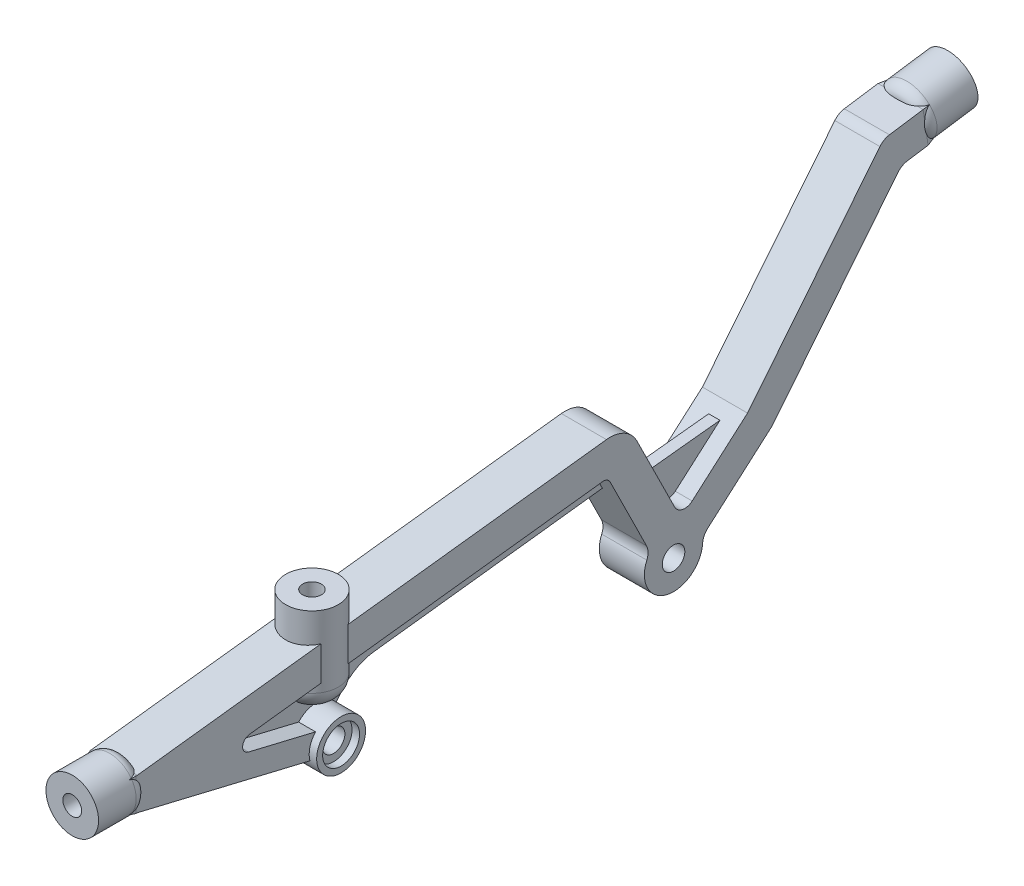
from build123d import *
from OCP.BRepFilletAPI import BRepFilletAPI_MakeChamfer
from build123d.topology import SkipClean

# Parameters (mm, degrees)
BOSS_EXTRUDE3_DEPTH      = 3
BOSS_EXTRUDE3_DEPTH_BACK = 3
SKETCH2_R                = 1.5
CHAMFER1_SIZE            = 5.5
CHAMFER1_SIZE2           = 0.969798394
SKETCH4_R                = 3.5
BOSS_EXTRUDE5_DEPTH      = 6.5
FILLET1_R                = 1.5
CHAMFER2_SIZE            = 6.5
CHAMFER2_SIZE2           = 1.146125375
SKETCH5_R                = 3.5
BOSS_EXTRUDE6_DEPTH      = 7
FILLET2_R                = 1.5
SKETCH6_R                = 1.25
CUT_EXTRUDE1_DEPTH       = 5
SKETCH7_R                = 1.25
CUT_EXTRUDE2_DEPTH       = 5
SKETCH8_R                = 3.25
SKETCH8_R_2              = 2.45625
BOSS_EXTRUDE7_DEPTH      = 1
SKETCH9_R                = 3.5
BOSS_EXTRUDE8_DEPTH      = 12
FILLET4_R                = 2.5
SKETCH10_R               = 1.25
CUT_EXTRUDE3_DEPTH       = 7.5
BOSS_EXTRUDE9_DEPTH      = 0.75
BOSS_EXTRUDE9_DEPTH_BACK = 0.75


with BuildPart() as part:
    # Sketch2 → Boss-Extrude3 (new, two sides: drawn at the far end of the back side and taken through both)
    with BuildSketch(Plane(origin=(0, 0, 0), x_dir=(0, 0, -1), z_dir=(1, 0, 0)).offset(-BOSS_EXTRUDE3_DEPTH_BACK)):
        with BuildLine():
            Line((-41.847406192, 4.214685059), (-47.504350649, 4.214685059))
            Line((-47.504350649, 4.214685059), (-47.504350649, -0.108292918))
            Line((-47.504350649, -0.108292918), (-41.847406192, -0.108292918))
            Line((-41.847406192, -0.108292918), (-18.896958647, -5.602873503))
            ThreePointArc((-18.896958647, -5.602873503), (-12.591071245, -5.627422554), (-18.143570936, -2.638348154))
            Line((-18.143570936, -2.638348154), (-27.07269919, -0.500620136))
            ThreePointArc((-27.07269919, -0.500620136), (-27.838191081, 0.529789455), (-26.958724721, 1.464808536))
            Line((-26.958724721, 1.464808536), (20.036892245, 7.090419127))
            ThreePointArc((20.036892245, 7.090419127), (20.631486114, 6.977095043), (21.051777308, 6.541504033))
            Line((21.051777308, 6.541504033), (25.882475091, -3.2073223))
            ThreePointArc((25.882475091, -3.2073223), (26.089769352, -4.044385692), (25.925361171, -4.890917429))
            ThreePointArc((25.925361171, -4.890917429), (28.584276955, -10.202316883), (33.349113245, -6.65589158))
            ThreePointArc((33.349113245, -6.65589158), (33.549055458, -5.89274102), (34.028557694, -5.26628011))
            Line((34.028557694, -5.26628011), (42.583090556, 2.221114582))
            Line((42.583090556, 2.221114582), (59.335624185, 23.053193016))
            ThreePointArc((59.335624185, 23.053193016), (59.900258067, 23.535386094), (60.601885484, 23.778368712))
            Line((60.601885484, 23.778368712), (69.77302999, 25.133284216))
            Line((69.77302999, 25.133284216), (69.115352949, 29.5849649))
            Line((69.115352949, 29.5849649), (58.200021846, 27.972368856))
            ThreePointArc((58.200021846, 27.972368856), (57.498394429, 27.729386238), (56.933760547, 27.247193161))
            Line((56.933760547, 27.247193161), (39.323061921, 5.347971039))
            Line((39.323061921, 5.347971039), (31.960980055, -1.095725371))
            ThreePointArc((31.960980055, -1.095725371), (30.681109601, -1.43831674), (29.629017471, -0.632997314))
            Line((29.629017471, -0.632997314), (24.61351539, 9.488782386))
            ThreePointArc((24.61351539, 9.488782386), (22.932350612, 11.231146425), (20.553975139, 11.684442759))
            Line((20.553975139, 11.684442759), (-41.847406192, 4.214685059))
        make_face()
        with Locations((29.480563746, -6.432397124)):
            Circle(SKETCH2_R, mode=Mode.SUBTRACT)
        with Locations((-15.740946388, -4.826931094)):
            Circle(SKETCH2_R, mode=Mode.SUBTRACT)
    extrude(amount=BOSS_EXTRUDE3_DEPTH + BOSS_EXTRUDE3_DEPTH_BACK)

    # Chamfer1: one chamfer whose edges measure the first distance from different faces: ONE call of the kernel's chamfer builder (chamfer() names one face for all edges)
    chamfer1_edges_1 = [part.edges().sort_by_distance(p)[0] for p in [
        (-3, 2.05319607, 47.504350649),
    ]]
    chamfer1_side_1 = [part.faces().sort_by_distance(p)[0] for p in [
        (-3, 6.287655967, -11.033571173),
    ]]
    chamfer1_edges_2 = [part.edges().sort_by_distance(p)[0] for p in [
        (0, -0.108292918, 47.504350649),
    ]]
    chamfer1_side_2 = [part.faces().sort_by_distance(p)[0] for p in [
        (0, -0.108292918, 44.67587842),
    ]]
    chamfer1_edges_3 = [part.edges().sort_by_distance(p)[0] for p in [
        (0, 4.214685059, 47.504350649),
    ]]
    chamfer1_side_3 = [part.faces().sort_by_distance(p)[0] for p in [
        (0, 4.214685059, 44.67587842),
    ]]
    chamfer1_edges_4 = [part.edges().sort_by_distance(p)[0] for p in [
        (3, 2.05319607, 47.504350649),
    ]]
    chamfer1_side_4 = [part.faces().sort_by_distance(p)[0] for p in [
        (3, 6.287655967, -11.033571173),
    ]]
    chamfer1 = BRepFilletAPI_MakeChamfer(part.part.solid().wrapped)
    for e in chamfer1_edges_1:
        chamfer1.Add(CHAMFER1_SIZE, CHAMFER1_SIZE2, e.wrapped, chamfer1_side_1[0].wrapped)  # the first distance lies on this face
    for e in chamfer1_edges_2:
        chamfer1.Add(CHAMFER1_SIZE, CHAMFER1_SIZE2, e.wrapped, chamfer1_side_2[0].wrapped)  # the first distance lies on this face
    for e in chamfer1_edges_3:
        chamfer1.Add(CHAMFER1_SIZE, CHAMFER1_SIZE2, e.wrapped, chamfer1_side_3[0].wrapped)  # the first distance lies on this face
    for e in chamfer1_edges_4:
        chamfer1.Add(CHAMFER1_SIZE, CHAMFER1_SIZE2, e.wrapped, chamfer1_side_4[0].wrapped)  # the first distance lies on this face
    add(Compound.cast(chamfer1.Shape()), mode=Mode.REPLACE)

    # Sketch4 → Boss-Extrude5 (add)
    with BuildSketch(Plane.XY.offset(47.504350649)):
        with Locations((0, 2.06015318)):
            Circle(SKETCH4_R)
    extrude(amount=-BOSS_EXTRUDE5_DEPTH)

    # Fillet1
    # the kernel refuses this fillet: 1.5 mm, written as the material it takes off along each edge
    with BuildSketch(Plane(origin=(0, 2.06015318, 41.004350649), x_dir=(0.04192374044801671, 0.9991208135089806, 0), z_dir=(0.9991208135089806, -0.04192374044801671, 0))) as fillet1_piece_1_section:
        with BuildLine():
            CenterArc((3.5 - FILLET1_R, FILLET1_R), FILLET1_R, 270, 90)
            Line((3.5 - FILLET1_R, 0), (3.5, 0))
            Line((3.5, 0), (3.5, FILLET1_R))
        make_face()
    fillet1_piece_1 = revolve(axis=Axis((0, 2.06015318, 41.004350649), (0, 0, 1)), revolution_arc=184.805515175, mode=Mode.PRIVATE)
    fillet1_piece_1 = split(fillet1_piece_1, bisect_by=Plane(origin=(-1.144767452, 4.344009615, 41.270914646), z_dir=(0, 0.984807753012208, 0.17364817766693078)), keep=Keep.TOP, mode=Mode.PRIVATE)
    add(fillet1_piece_1, mode=Mode.SUBTRACT)
    with BuildSketch(Plane(origin=(0, 2.06015318, 41.004350649), x_dir=(0.04192374044801671, 0.9991208135089806, 0), z_dir=(0.9991208135089806, -0.04192374044801671, 0))) as fillet1_piece_2_section:
        with BuildLine():
            CenterArc((3.5 - FILLET1_R, FILLET1_R), FILLET1_R, 270, 90)
            Line((3.5 - FILLET1_R, 0), (3.5, 0))
            Line((3.5, 0), (3.5, FILLET1_R))
        make_face()
    fillet1_piece_2 = revolve(axis=Axis((0, 2.06015318, 41.004350649), (0, 0, 1)), revolution_arc=184.805515175, mode=Mode.PRIVATE)
    fillet1_piece_2 = split(fillet1_piece_2, bisect_by=Plane(origin=(-1.98088056, 4.214685059, 41.226581935), z_dir=(0, 1, 0)), keep=Keep.TOP, mode=Mode.PRIVATE)
    fillet1_piece_2 = split(fillet1_piece_2, bisect_by=Plane(origin=(-1.98088056, 4.289448438, 41.222842676), z_dir=(0, 0.9929114459492596, 0.11885647017706114)), keep=Keep.TOP, mode=Mode.PRIVATE)
    add(fillet1_piece_2, mode=Mode.SUBTRACT)
    with BuildSketch(Plane(origin=(0, 2.06015318, 41.004350649), x_dir=(0.04192374044801671, 0.9991208135089806, 0), z_dir=(0.9991208135089806, -0.04192374044801671, 0))) as fillet1_piece_3_section:
        with BuildLine():
            CenterArc((3.5 - FILLET1_R, FILLET1_R), FILLET1_R, 270, 90)
            Line((3.5 - FILLET1_R, 0), (3.5, 0))
            Line((3.5, 0), (3.5, FILLET1_R))
        make_face()
    fillet1_piece_3 = revolve(axis=Axis((0, 2.06015318, 41.004350649), (0, 0, 1)), revolution_arc=184.805515175, mode=Mode.PRIVATE)
    fillet1_piece_3 = split(fillet1_piece_3, bisect_by=Plane(origin=(-2.965659211, 0.262612225, 42.199106941), z_dir=(-0.984807753012208, 0, 0.17364817766693078)), keep=Keep.TOP, mode=Mode.PRIVATE)
    add(fillet1_piece_3, mode=Mode.SUBTRACT)
    with BuildSketch(Plane(origin=(0, 2.06015318, 41.004350649), x_dir=(0.04192374044801671, 0.9991208135089806, 0), z_dir=(0.9991208135089806, -0.04192374044801671, 0))) as fillet1_piece_4_section:
        with BuildLine():
            CenterArc((3.5 - FILLET1_R, FILLET1_R), FILLET1_R, 270, 90)
            Line((3.5 - FILLET1_R, 0), (3.5, 0))
            Line((3.5, 0), (3.5, FILLET1_R))
        make_face()
    fillet1_piece_4 = revolve(axis=Axis((0, 2.06015318, 41.004350649), (0, 0, 1)), revolution_arc=184.805515175, mode=Mode.PRIVATE)
    fillet1_piece_4 = split(fillet1_piece_4, bisect_by=Plane(origin=(-3, 2.060153209, 41.267954921), z_dir=(-1, 0, 0)), keep=Keep.TOP, mode=Mode.PRIVATE)
    add(fillet1_piece_4, mode=Mode.SUBTRACT)
    with BuildSketch(Plane(origin=(0, 2.06015318, 41.004350649), x_dir=(0.04192374044801671, 0.9991208135089806, 0), z_dir=(0.9991208135089806, -0.04192374044801671, 0))) as fillet1_piece_5_section:
        with BuildLine():
            CenterArc((3.5 - FILLET1_R, FILLET1_R), FILLET1_R, 270, 90)
            Line((3.5 - FILLET1_R, 0), (3.5, 0))
            Line((3.5, 0), (3.5, FILLET1_R))
        make_face()
    fillet1_piece_5 = revolve(axis=Axis((0, 2.06015318, 41.004350649), (0, 0, 1)), revolution_arc=184.805515175, mode=Mode.PRIVATE)
    fillet1_piece_5 = split(fillet1_piece_5, bisect_by=Plane(origin=(-2.550851297, -0.143060854, 41.702183155), z_dir=(0, -0.9725172253402184, 0.23283093956036607)), keep=Keep.TOP, mode=Mode.PRIVATE)
    fillet1_piece_5 = split(fillet1_piece_5, bisect_by=Plane(origin=(-2.550851297, -0.108292918, 41.704499733), z_dir=(0, -1, 0)), keep=Keep.TOP, mode=Mode.PRIVATE)
    add(fillet1_piece_5, mode=Mode.SUBTRACT)
    with BuildSketch(Plane(origin=(0, 2.06015318, 41.004350649), x_dir=(0.04192374044801671, 0.9991208135089806, 0), z_dir=(0.9991208135089806, -0.04192374044801671, 0))) as fillet1_piece_6_section:
        with BuildLine():
            CenterArc((3.5 - FILLET1_R, FILLET1_R), FILLET1_R, 270, 90)
            Line((3.5 - FILLET1_R, 0), (3.5, 0))
            Line((3.5, 0), (3.5, FILLET1_R))
        make_face()
    fillet1_piece_6 = revolve(axis=Axis((0, 2.06015318, 41.004350649), (0, 0, 1)), revolution_arc=184.805515175, mode=Mode.PRIVATE)
    fillet1_piece_6 = split(fillet1_piece_6, bisect_by=Plane(origin=(-2.739285489, -0.108292918, 42.203267958), z_dir=(0, 1, 0)), keep=Keep.TOP, mode=Mode.PRIVATE)
    fillet1_piece_6 = split(fillet1_piece_6, bisect_by=Plane(origin=(-2.739285489, -0.073748336, 42.200262712), z_dir=(0, -0.9848077530122082, 0.17364817766693047)), keep=Keep.TOP, mode=Mode.PRIVATE)
    add(fillet1_piece_6, mode=Mode.SUBTRACT)
    with BuildSketch(Plane(origin=(0, 2.06015318, 41.004350649), x_dir=(1, 0, 0), z_dir=(0, -1, 0))) as fillet1_piece_7_section:
        with BuildLine():
            CenterArc((3.5 - FILLET1_R, FILLET1_R), FILLET1_R, 270, 90)
            Line((3.5 - FILLET1_R, 0), (3.5, 0))
            Line((3.5, 0), (3.5, FILLET1_R))
        make_face()
    fillet1_piece_7 = revolve(axis=Axis((0, 2.06015318, 41.004350649), (0, 0, 1)), revolution_arc=92.393979849, mode=Mode.PRIVATE)
    fillet1_piece_7 = split(fillet1_piece_7, bisect_by=Plane(origin=(3.092592479, 2.737440742, 41.479232603), z_dir=(0.984807753012208, 0, 0.17364817766693078)), keep=Keep.TOP, mode=Mode.PRIVATE)
    add(fillet1_piece_7, mode=Mode.SUBTRACT)
    with BuildSketch(Plane(origin=(0, 2.06015318, 41.004350649), x_dir=(1, 0, 0), z_dir=(0, -1, 0))) as fillet1_piece_8_section:
        with BuildLine():
            CenterArc((3.5 - FILLET1_R, FILLET1_R), FILLET1_R, 270, 90)
            Line((3.5 - FILLET1_R, 0), (3.5, 0))
            Line((3.5, 0), (3.5, FILLET1_R))
        make_face()
    fillet1_piece_8 = revolve(axis=Axis((0, 2.06015318, 41.004350649), (0, 0, 1)), revolution_arc=92.393979849, mode=Mode.PRIVATE)
    fillet1_piece_8 = split(fillet1_piece_8, bisect_by=Plane(origin=(3, 2.979684864, 41.26795494), z_dir=(1, 0, 0)), keep=Keep.TOP, mode=Mode.PRIVATE)
    add(fillet1_piece_8, mode=Mode.SUBTRACT)
    with BuildSketch(Plane(origin=(0, 2.06015318, 41.004350649), x_dir=(1, 0, 0), z_dir=(0, -1, 0))) as fillet1_piece_9_section:
        with BuildLine():
            CenterArc((3.5 - FILLET1_R, FILLET1_R), FILLET1_R, 270, 90)
            Line((3.5 - FILLET1_R, 0), (3.5, 0))
            Line((3.5, 0), (3.5, FILLET1_R))
        make_face()
    fillet1_piece_9 = revolve(axis=Axis((0, 2.06015318, 41.004350649), (0, 0, 1)), revolution_arc=92.393979849, mode=Mode.PRIVATE)
    fillet1_piece_9 = split(fillet1_piece_9, bisect_by=Plane(origin=(2.808020408, 4.14438703, 42.40303058), z_dir=(0, 0.984807753012208, 0.17364817766693078)), keep=Keep.TOP, mode=Mode.PRIVATE)
    add(fillet1_piece_9, mode=Mode.SUBTRACT)
    with BuildSketch(Plane(origin=(0, 2.06015318, 41.004350649), x_dir=(1, 0, 0), z_dir=(0, -1, 0))) as fillet1_piece_10_section:
        with BuildLine():
            CenterArc((3.5 - FILLET1_R, FILLET1_R), FILLET1_R, 270, 90)
            Line((3.5 - FILLET1_R, 0), (3.5, 0))
            Line((3.5, 0), (3.5, FILLET1_R))
        make_face()
    fillet1_piece_10 = revolve(axis=Axis((0, 2.06015318, 41.004350649), (0, 0, 1)), revolution_arc=92.393979849, mode=Mode.PRIVATE)
    fillet1_piece_10 = split(fillet1_piece_10, bisect_by=Plane(origin=(1.980919647, 4.28944822, 41.222844499), z_dir=(0, 0.9929114459492596, 0.11885647017706114)), keep=Keep.TOP, mode=Mode.PRIVATE)
    fillet1_piece_10 = split(fillet1_piece_10, bisect_by=Plane(origin=(1.980919647, 4.214685059, 41.226583423), z_dir=(0, 1, 0)), keep=Keep.TOP, mode=Mode.PRIVATE)
    add(fillet1_piece_10, mode=Mode.SUBTRACT)
    with BuildSketch(Plane(origin=(0, 2.06015318, 41.004350649), x_dir=(-0.9467133479800277, 0.3220773769708873, 0), z_dir=(0.3220773769708873, 0.9467133479800277, 0))) as fillet1_piece_11_section:
        with BuildLine():
            CenterArc((3.5 - FILLET1_R, FILLET1_R), FILLET1_R, 270, 90)
            Line((3.5 - FILLET1_R, 0), (3.5, 0))
            Line((3.5, 0), (3.5, FILLET1_R))
        make_face()
    fillet1_piece_11 = revolve(axis=Axis((0, 2.06015318, 41.004350649), (0, 0, 1)), revolution_arc=217.577204913, mode=Mode.PRIVATE)
    fillet1_piece_11 = split(fillet1_piece_11, bisect_by=Plane(origin=(-3.095548759, 1.915452294, 41.462466708), z_dir=(-0.984807753012208, 0, 0.17364817766693078)), keep=Keep.TOP, mode=Mode.PRIVATE)
    add(fillet1_piece_11, mode=Mode.SUBTRACT)
    with BuildSketch(Plane(origin=(0, 2.06015318, 41.004350649), x_dir=(-0.9467133479800277, 0.3220773769708873, 0), z_dir=(0.3220773769708873, 0.9467133479800277, 0))) as fillet1_piece_12_section:
        with BuildLine():
            CenterArc((3.5 - FILLET1_R, FILLET1_R), FILLET1_R, 270, 90)
            Line((3.5 - FILLET1_R, 0), (3.5, 0))
            Line((3.5, 0), (3.5, FILLET1_R))
        make_face()
    fillet1_piece_12 = revolve(axis=Axis((0, 2.06015318, 41.004350649), (0, 0, 1)), revolution_arc=217.577204913, mode=Mode.PRIVATE)
    fillet1_piece_12 = split(fillet1_piece_12, bisect_by=Plane(origin=(-3, 1.661101297, 41.251445083), z_dir=(-1, 0, 0)), keep=Keep.TOP, mode=Mode.PRIVATE)
    add(fillet1_piece_12, mode=Mode.SUBTRACT)
    with BuildSketch(Plane(origin=(0, 2.06015318, 41.004350649), x_dir=(-0.9467133479800277, 0.3220773769708873, 0), z_dir=(0.3220773769708873, 0.9467133479800277, 0))) as fillet1_piece_13_section:
        with BuildLine():
            CenterArc((3.5 - FILLET1_R, FILLET1_R), FILLET1_R, 270, 90)
            Line((3.5 - FILLET1_R, 0), (3.5, 0))
            Line((3.5, 0), (3.5, FILLET1_R))
        make_face()
    fillet1_piece_13 = revolve(axis=Axis((0, 2.06015318, 41.004350649), (0, 0, 1)), revolution_arc=217.577204913, mode=Mode.PRIVATE)
    fillet1_piece_13 = split(fillet1_piece_13, bisect_by=Plane(origin=(3, 1.661101311, 41.251445112), z_dir=(1, 0, 0)), keep=Keep.TOP, mode=Mode.PRIVATE)
    add(fillet1_piece_13, mode=Mode.SUBTRACT)
    with BuildSketch(Plane(origin=(0, 2.06015318, 41.004350649), x_dir=(-0.9467133479800277, 0.3220773769708873, 0), z_dir=(0.3220773769708873, 0.9467133479800277, 0))) as fillet1_piece_14_section:
        with BuildLine():
            CenterArc((3.5 - FILLET1_R, FILLET1_R), FILLET1_R, 270, 90)
            Line((3.5 - FILLET1_R, 0), (3.5, 0))
            Line((3.5, 0), (3.5, FILLET1_R))
        make_face()
    fillet1_piece_14 = revolve(axis=Axis((0, 2.06015318, 41.004350649), (0, 0, 1)), revolution_arc=217.577204913, mode=Mode.PRIVATE)
    fillet1_piece_14 = split(fillet1_piece_14, bisect_by=Plane(origin=(2.965659211, 0.262612225, 42.19910694), z_dir=(0.984807753012208, 0, 0.17364817766693078)), keep=Keep.TOP, mode=Mode.PRIVATE)
    add(fillet1_piece_14, mode=Mode.SUBTRACT)
    with BuildSketch(Plane(origin=(0, 2.06015318, 41.004350649), x_dir=(-0.9467133479800277, 0.3220773769708873, 0), z_dir=(0.3220773769708873, 0.9467133479800277, 0))) as fillet1_piece_15_section:
        with BuildLine():
            CenterArc((3.5 - FILLET1_R, FILLET1_R), FILLET1_R, 270, 90)
            Line((3.5 - FILLET1_R, 0), (3.5, 0))
            Line((3.5, 0), (3.5, FILLET1_R))
        make_face()
    fillet1_piece_15 = revolve(axis=Axis((0, 2.06015318, 41.004350649), (0, 0, 1)), revolution_arc=217.577204913, mode=Mode.PRIVATE)
    fillet1_piece_15 = split(fillet1_piece_15, bisect_by=Plane(origin=(2.739285464, -0.02676555, 42.187939845), z_dir=(0, -0.9725172253402184, 0.23283093956036607)), keep=Keep.TOP, mode=Mode.PRIVATE)
    fillet1_piece_15 = split(fillet1_piece_15, bisect_by=Plane(origin=(2.739285464, -0.073748254, 42.200263173), z_dir=(0, -0.9848077530122082, 0.17364817766693047)), keep=Keep.TOP, mode=Mode.PRIVATE)
    add(fillet1_piece_15, mode=Mode.SUBTRACT)
    with BuildSketch(Plane(origin=(0, 2.06015318, 41.004350649), x_dir=(-0.9467133479800277, 0.3220773769708873, 0), z_dir=(0.3220773769708873, 0.9467133479800277, 0))) as fillet1_piece_16_section:
        with BuildLine():
            CenterArc((3.5 - FILLET1_R, FILLET1_R), FILLET1_R, 270, 90)
            Line((3.5 - FILLET1_R, 0), (3.5, 0))
            Line((3.5, 0), (3.5, FILLET1_R))
        make_face()
    fillet1_piece_16 = revolve(axis=Axis((0, 2.06015318, 41.004350649), (0, 0, 1)), revolution_arc=217.577204913, mode=Mode.PRIVATE)
    fillet1_piece_16 = split(fillet1_piece_16, bisect_by=Plane(origin=(2.55085127, -0.143060856, 41.702183144), z_dir=(0, -0.9725172253402184, 0.23283093956036607)), keep=Keep.TOP, mode=Mode.PRIVATE)
    fillet1_piece_16 = split(fillet1_piece_16, bisect_by=Plane(origin=(2.55085127, -0.108292918, 41.704499723), z_dir=(0, -1, 0)), keep=Keep.TOP, mode=Mode.PRIVATE)
    add(fillet1_piece_16, mode=Mode.SUBTRACT)
    with BuildSketch(Plane(origin=(0, 2.06015318, 41.004350649), x_dir=(0.9317111197747436, -0.3632002055176914, 0), z_dir=(-0.3632002055176914, -0.9317111197747436, 0))) as fillet1_piece_17_section:
        with BuildLine():
            CenterArc((3.5 - FILLET1_R, FILLET1_R), FILLET1_R, 270, 90)
            Line((3.5 - FILLET1_R, 0), (3.5, 0))
            Line((3.5, 0), (3.5, FILLET1_R))
        make_face()
    fillet1_piece_17 = revolve(axis=Axis((0, 2.06015318, 41.004350649), (0, 0, 1)), revolution_arc=222.593724351, mode=Mode.PRIVATE)
    fillet1_piece_17 = split(fillet1_piece_17, bisect_by=Plane(origin=(3.095045388, 2.152504138, 41.46532147), z_dir=(0.984807753012208, 0, 0.17364817766693078)), keep=Keep.TOP, mode=Mode.PRIVATE)
    add(fillet1_piece_17, mode=Mode.SUBTRACT)
    with BuildSketch(Plane(origin=(0, 2.06015318, 41.004350649), x_dir=(0.9317111197747436, -0.3632002055176914, 0), z_dir=(-0.3632002055176914, -0.9317111197747436, 0))) as fillet1_piece_18_section:
        with BuildLine():
            CenterArc((3.5 - FILLET1_R, FILLET1_R), FILLET1_R, 270, 90)
            Line((3.5 - FILLET1_R, 0), (3.5, 0))
            Line((3.5, 0), (3.5, FILLET1_R))
        make_face()
    fillet1_piece_18 = revolve(axis=Axis((0, 2.06015318, 41.004350649), (0, 0, 1)), revolution_arc=222.593724351, mode=Mode.PRIVATE)
    fillet1_piece_18 = split(fillet1_piece_18, bisect_by=Plane(origin=(3, 2.371265463, 41.252663145), z_dir=(1, 0, 0)), keep=Keep.TOP, mode=Mode.PRIVATE)
    add(fillet1_piece_18, mode=Mode.SUBTRACT)
    with BuildSketch(Plane(origin=(0, 2.06015318, 41.004350649), x_dir=(0.9317111197747436, -0.3632002055176914, 0), z_dir=(-0.3632002055176914, -0.9317111197747436, 0))) as fillet1_piece_19_section:
        with BuildLine():
            CenterArc((3.5 - FILLET1_R, FILLET1_R), FILLET1_R, 270, 90)
            Line((3.5 - FILLET1_R, 0), (3.5, 0))
            Line((3.5, 0), (3.5, FILLET1_R))
        make_face()
    fillet1_piece_19 = revolve(axis=Axis((0, 2.06015318, 41.004350649), (0, 0, 1)), revolution_arc=222.593724351, mode=Mode.PRIVATE)
    fillet1_piece_19 = split(fillet1_piece_19, bisect_by=Plane(origin=(-3, 2.371265462, 41.252663165), z_dir=(-1, 0, 0)), keep=Keep.TOP, mode=Mode.PRIVATE)
    add(fillet1_piece_19, mode=Mode.SUBTRACT)
    with BuildSketch(Plane(origin=(0, 2.06015318, 41.004350649), x_dir=(0.9317111197747436, -0.3632002055176914, 0), z_dir=(-0.3632002055176914, -0.9317111197747436, 0))) as fillet1_piece_20_section:
        with BuildLine():
            CenterArc((3.5 - FILLET1_R, FILLET1_R), FILLET1_R, 270, 90)
            Line((3.5 - FILLET1_R, 0), (3.5, 0))
            Line((3.5, 0), (3.5, FILLET1_R))
        make_face()
    fillet1_piece_20 = revolve(axis=Axis((0, 2.06015318, 41.004350649), (0, 0, 1)), revolution_arc=222.593724351, mode=Mode.PRIVATE)
    fillet1_piece_20 = split(fillet1_piece_20, bisect_by=Plane(origin=(-2.965659309, 3.857694157, 42.199106385), z_dir=(-0.984807753012208, 0, 0.17364817766693078)), keep=Keep.TOP, mode=Mode.PRIVATE)
    add(fillet1_piece_20, mode=Mode.SUBTRACT)
    with BuildSketch(Plane(origin=(0, 2.06015318, 41.004350649), x_dir=(0.9317111197747436, -0.3632002055176914, 0), z_dir=(-0.3632002055176914, -0.9317111197747436, 0))) as fillet1_piece_21_section:
        with BuildLine():
            CenterArc((3.5 - FILLET1_R, FILLET1_R), FILLET1_R, 270, 90)
            Line((3.5 - FILLET1_R, 0), (3.5, 0))
            Line((3.5, 0), (3.5, FILLET1_R))
        make_face()
    fillet1_piece_21 = revolve(axis=Axis((0, 2.06015318, 41.004350649), (0, 0, 1)), revolution_arc=222.593724351, mode=Mode.PRIVATE)
    fillet1_piece_21 = split(fillet1_piece_21, bisect_by=Plane(origin=(-2.808020404, 4.144387171, 42.403029783), z_dir=(0, 0.984807753012208, 0.17364817766693078)), keep=Keep.TOP, mode=Mode.PRIVATE)
    add(fillet1_piece_21, mode=Mode.SUBTRACT)
    with BuildSketch(Plane(origin=(0, 2.06015318, 41.004350649), x_dir=(0.9317111197747436, -0.3632002055176914, 0), z_dir=(-0.3632002055176914, -0.9317111197747436, 0))) as fillet1_piece_22_section:
        with BuildLine():
            CenterArc((3.5 - FILLET1_R, FILLET1_R), FILLET1_R, 270, 90)
            Line((3.5 - FILLET1_R, 0), (3.5, 0))
            Line((3.5, 0), (3.5, FILLET1_R))
        make_face()
    fillet1_piece_22 = revolve(axis=Axis((0, 2.06015318, 41.004350649), (0, 0, 1)), revolution_arc=222.593724351, mode=Mode.PRIVATE)
    fillet1_piece_22 = split(fillet1_piece_22, bisect_by=Plane(origin=(1.254176178, 4.214685059, 41.116803645), z_dir=(0, 1, 0)), keep=Keep.TOP, mode=Mode.PRIVATE)
    fillet1_piece_22 = split(fillet1_piece_22, bisect_by=Plane(origin=(1.254176178, 4.302341009, 41.115139821), z_dir=(0, 0.9929114459492596, 0.11885647017706114)), keep=Keep.TOP, mode=Mode.PRIVATE)
    add(fillet1_piece_22, mode=Mode.SUBTRACT)
    with BuildSketch(Plane(origin=(0, 2.06015318, 41.004350649), x_dir=(-0.041770674206742874, -0.9991272245196375, 0), z_dir=(-0.9991272245196375, 0.041770674206742874, 0))) as fillet1_piece_23_section:
        with BuildLine():
            CenterArc((3.5 - FILLET1_R, FILLET1_R), FILLET1_R, 270, 90)
            Line((3.5 - FILLET1_R, 0), (3.5, 0))
            Line((3.5, 0), (3.5, FILLET1_R))
        make_face()
    fillet1_piece_23 = revolve(axis=Axis((0, 2.06015318, 41.004350649), (0, 0, 1)), revolution_arc=92.393979849, mode=Mode.PRIVATE)
    fillet1_piece_23 = split(fillet1_piece_23, bisect_by=Plane(origin=(1.133722767, -0.254084438, 41.238446042), z_dir=(0, -0.9725172253402184, 0.23283093956036607)), keep=Keep.TOP, mode=Mode.PRIVATE)
    fillet1_piece_23 = split(fillet1_piece_23, bisect_by=Plane(origin=(1.133722767, -0.237034083, 41.274223222), z_dir=(0, -0.9848077530122082, 0.17364817766693047)), keep=Keep.TOP, mode=Mode.PRIVATE)
    add(fillet1_piece_23, mode=Mode.SUBTRACT)
    with BuildSketch(Plane(origin=(0, 2.06015318, 41.004350649), x_dir=(-0.041770674206742874, -0.9991272245196375, 0), z_dir=(-0.9991272245196375, 0.041770674206742874, 0))) as fillet1_piece_24_section:
        with BuildLine():
            CenterArc((3.5 - FILLET1_R, FILLET1_R), FILLET1_R, 270, 90)
            Line((3.5 - FILLET1_R, 0), (3.5, 0))
            Line((3.5, 0), (3.5, FILLET1_R))
        make_face()
    fillet1_piece_24 = revolve(axis=Axis((0, 2.06015318, 41.004350649), (0, 0, 1)), revolution_arc=92.393979849, mode=Mode.PRIVATE)
    fillet1_piece_24 = split(fillet1_piece_24, bisect_by=Plane(origin=(2.550851289, -0.143060858, 41.702183138), z_dir=(0, -0.9725172253402184, 0.23283093956036607)), keep=Keep.TOP, mode=Mode.PRIVATE)
    fillet1_piece_24 = split(fillet1_piece_24, bisect_by=Plane(origin=(2.550851289, -0.108292918, 41.704499714), z_dir=(0, -1, 0)), keep=Keep.TOP, mode=Mode.PRIVATE)
    add(fillet1_piece_24, mode=Mode.SUBTRACT)
    with BuildSketch(Plane(origin=(0, 2.06015318, 41.004350649), x_dir=(-0.041770674206742874, -0.9991272245196375, 0), z_dir=(-0.9991272245196375, 0.041770674206742874, 0))) as fillet1_piece_25_section:
        with BuildLine():
            CenterArc((3.5 - FILLET1_R, FILLET1_R), FILLET1_R, 270, 90)
            Line((3.5 - FILLET1_R, 0), (3.5, 0))
            Line((3.5, 0), (3.5, FILLET1_R))
        make_face()
    fillet1_piece_25 = revolve(axis=Axis((0, 2.06015318, 41.004350649), (0, 0, 1)), revolution_arc=92.393979849, mode=Mode.PRIVATE)
    fillet1_piece_25 = split(fillet1_piece_25, bisect_by=Plane(origin=(3, 1.140621517, 41.267954982), z_dir=(1, 0, 0)), keep=Keep.TOP, mode=Mode.PRIVATE)
    add(fillet1_piece_25, mode=Mode.SUBTRACT)
    with BuildSketch(Plane(origin=(0, 2.06015318, 41.004350649), x_dir=(-0.041770674206742874, -0.9991272245196375, 0), z_dir=(-0.9991272245196375, 0.041770674206742874, 0))) as fillet1_piece_26_section:
        with BuildLine():
            CenterArc((3.5 - FILLET1_R, FILLET1_R), FILLET1_R, 270, 90)
            Line((3.5 - FILLET1_R, 0), (3.5, 0))
            Line((3.5, 0), (3.5, FILLET1_R))
        make_face()
    fillet1_piece_26 = revolve(axis=Axis((0, 2.06015318, 41.004350649), (0, 0, 1)), revolution_arc=92.393979849, mode=Mode.PRIVATE)
    fillet1_piece_26 = split(fillet1_piece_26, bisect_by=Plane(origin=(2.965659211, 0.262612226, 42.199106942), z_dir=(0.984807753012208, 0, 0.17364817766693078)), keep=Keep.TOP, mode=Mode.PRIVATE)
    add(fillet1_piece_26, mode=Mode.SUBTRACT)

    # Chamfer2: one chamfer whose edges measure the first distance from different faces: ONE call of the kernel's chamfer builder (chamfer() names one face for all edges)
    chamfer2_edges_1 = [part.edges().sort_by_distance(p)[0] for p in [
        (0, 29.5849649, -69.115352949),
    ]]
    chamfer2_side_1 = [part.faces().sort_by_distance(p)[0] for p in [
        (0, 28.778666878, -63.657687398),
    ]]
    chamfer2_edges_2 = [part.edges().sort_by_distance(p)[0] for p in [
        (0, 25.133284216, -69.77302999),
    ]]
    chamfer2_side_2 = [part.faces().sort_by_distance(p)[0] for p in [
        (0, 24.455826464, -65.187457737),
    ]]
    chamfer2_edges_3 = [part.edges().sort_by_distance(p)[0] for p in [
        (-3, 27.359124558, -69.444191469),
    ]]
    chamfer2_side_3 = [part.faces().sort_by_distance(p)[0] for p in [
        (-3, 6.438644919, -13.016769685),
    ]]
    chamfer2_edges_4 = [part.edges().sort_by_distance(p)[0] for p in [
        (3, 27.359124558, -69.444191469),
    ]]
    chamfer2_side_4 = [part.faces().sort_by_distance(p)[0] for p in [
        (3, 6.438644909, -13.016769556),
    ]]
    chamfer2 = BRepFilletAPI_MakeChamfer(part.part.solid().wrapped)
    for e in chamfer2_edges_1:
        chamfer2.Add(CHAMFER2_SIZE, CHAMFER2_SIZE2, e.wrapped, chamfer2_side_1[0].wrapped)  # the first distance lies on this face
    for e in chamfer2_edges_2:
        chamfer2.Add(CHAMFER2_SIZE, CHAMFER2_SIZE2, e.wrapped, chamfer2_side_2[0].wrapped)  # the first distance lies on this face
    for e in chamfer2_edges_3:
        chamfer2.Add(CHAMFER2_SIZE, CHAMFER2_SIZE2, e.wrapped, chamfer2_side_3[0].wrapped)  # the first distance lies on this face
    for e in chamfer2_edges_4:
        chamfer2.Add(CHAMFER2_SIZE, CHAMFER2_SIZE2, e.wrapped, chamfer2_side_4[0].wrapped)  # the first distance lies on this face
    add(Compound.cast(chamfer2.Shape()), mode=Mode.REPLACE)

    # Sketch5 → Boss-Extrude6 (add)
    with BuildSketch(Plane(origin=(0, 10.62471036, -71.916480205), x_dir=(-1, 0, 0), z_dir=(0, 0.14615045349945946, -0.9892623741666832))):
        with Locations(Location((0, 16.916052439, 0), (0, 0, 90))):
            Circle(SKETCH5_R)
    extrude(amount=-BOSS_EXTRUDE6_DEPTH)

    # Fillet2
    # the kernel refuses this fillet: 1.5 mm, written as the material it takes off along each edge
    with BuildSketch(Plane(origin=(0, 26.336071383, -62.51935485), x_dir=(-0.04192374044801691, 0.9883926280512421, 0.14602195999508588), z_dir=(-0.9991208135089809, -0.041473579009553015, -0.006127173678871303))) as fillet2_piece_1_section:
        with BuildLine():
            CenterArc((3.5 - FILLET2_R, FILLET2_R), FILLET2_R, 270, 90)
            Line((3.5 - FILLET2_R, 0), (3.5, 0))
            Line((3.5, 0), (3.5, FILLET2_R))
        make_face()
    fillet2_piece_1 = revolve(axis=Axis((0, 26.336071383, -62.51935485), (0, 0.14615045349945946, -0.9892623741666832)), revolution_arc=184.805515175, mode=Mode.PRIVATE)
    fillet2_piece_1 = split(fillet2_piece_1, bisect_by=Plane(origin=(1.133112953, 28.64164686, -62.44613546), z_dir=(0, 0.99961201575799, -0.027853508795987945)), keep=Keep.TOP, mode=Mode.PRIVATE)
    add(fillet2_piece_1, mode=Mode.SUBTRACT)
    with BuildSketch(Plane(origin=(0, 26.336071383, -62.51935485), x_dir=(-0.04192374044801691, 0.9883926280512421, 0.14602195999508588), z_dir=(-0.9991208135089809, -0.041473579009553015, -0.006127173678871303))) as fillet2_piece_2_section:
        with BuildLine():
            CenterArc((3.5 - FILLET2_R, FILLET2_R), FILLET2_R, 270, 90)
            Line((3.5 - FILLET2_R, 0), (3.5, 0))
            Line((3.5, 0), (3.5, FILLET2_R))
        make_face()
    fillet2_piece_2 = revolve(axis=Axis((0, 26.336071383, -62.51935485), (0, 0.14615045349945946, -0.9892623741666832)), revolution_arc=184.805515175, mode=Mode.PRIVATE)
    fillet2_piece_2 = split(fillet2_piece_2, bisect_by=Plane(origin=(1.79174701, 28.579661756, -62.310662636), z_dir=(0, 0.9892623741666831, 0.14615045349945954)), keep=Keep.TOP, mode=Mode.PRIVATE)
    add(fillet2_piece_2, mode=Mode.SUBTRACT)
    with BuildSketch(Plane(origin=(0, 26.336071383, -62.51935485), x_dir=(-0.04192374044801691, 0.9883926280512421, 0.14602195999508588), z_dir=(-0.9991208135089809, -0.041473579009553015, -0.006127173678871303))) as fillet2_piece_3_section:
        with BuildLine():
            CenterArc((3.5 - FILLET2_R, FILLET2_R), FILLET2_R, 270, 90)
            Line((3.5 - FILLET2_R, 0), (3.5, 0))
            Line((3.5, 0), (3.5, FILLET2_R))
        make_face()
    fillet2_piece_3 = revolve(axis=Axis((0, 26.336071383, -62.51935485), (0, 0.14615045349945946, -0.9892623741666832)), revolution_arc=184.805515175, mode=Mode.PRIVATE)
    fillet2_piece_3 = split(fillet2_piece_3, bisect_by=Plane(origin=(1.79174729, 24.127981067, -62.968339644), z_dir=(0, -0.989262374166683, -0.14615045349946)), keep=Keep.TOP, mode=Mode.PRIVATE)
    add(fillet2_piece_3, mode=Mode.SUBTRACT)
    with BuildSketch(Plane(origin=(0, 26.336071383, -62.51935485), x_dir=(-0.04192374044801691, 0.9883926280512421, 0.14602195999508588), z_dir=(-0.9991208135089809, -0.041473579009553015, -0.006127173678871303))) as fillet2_piece_4_section:
        with BuildLine():
            CenterArc((3.5 - FILLET2_R, FILLET2_R), FILLET2_R, 270, 90)
            Line((3.5 - FILLET2_R, 0), (3.5, 0))
            Line((3.5, 0), (3.5, FILLET2_R))
        make_face()
    fillet2_piece_4 = revolve(axis=Axis((0, 26.336071383, -62.51935485), (0, 0.14615045349945946, -0.9892623741666832)), revolution_arc=184.805515175, mode=Mode.PRIVATE)
    fillet2_piece_4 = split(fillet2_piece_4, bisect_by=Plane(origin=(2.61199571, 24.306759128, -63.713853113), z_dir=(0, -0.9488544959272366, -0.31571370822102407)), keep=Keep.TOP, mode=Mode.PRIVATE)
    add(fillet2_piece_4, mode=Mode.SUBTRACT)
    with BuildSketch(Plane(origin=(0, 26.336071383, -62.51935485), x_dir=(-0.04192374044801691, 0.9883926280512421, 0.14602195999508588), z_dir=(-0.9991208135089809, -0.041473579009553015, -0.006127173678871303))) as fillet2_piece_5_section:
        with BuildLine():
            CenterArc((3.5 - FILLET2_R, FILLET2_R), FILLET2_R, 270, 90)
            Line((3.5 - FILLET2_R, 0), (3.5, 0))
            Line((3.5, 0), (3.5, FILLET2_R))
        make_face()
    fillet2_piece_5 = revolve(axis=Axis((0, 26.336071383, -62.51935485), (0, 0.14615045349945946, -0.9892623741666832)), revolution_arc=184.805515175, mode=Mode.PRIVATE)
    fillet2_piece_5 = split(fillet2_piece_5, bisect_by=Plane(origin=(2.933731558, 24.785223615, -63.633805519), z_dir=(0.9848077530122081, 0.025378759915376754, -0.17178360850850583)), keep=Keep.TOP, mode=Mode.PRIVATE)
    add(fillet2_piece_5, mode=Mode.SUBTRACT)
    with BuildSketch(Plane(origin=(0, 26.336071383, -62.51935485), x_dir=(-0.04192374044801691, 0.9883926280512421, 0.14602195999508588), z_dir=(-0.9991208135089809, -0.041473579009553015, -0.006127173678871303))) as fillet2_piece_6_section:
        with BuildLine():
            CenterArc((3.5 - FILLET2_R, FILLET2_R), FILLET2_R, 270, 90)
            Line((3.5 - FILLET2_R, 0), (3.5, 0))
            Line((3.5, 0), (3.5, FILLET2_R))
        make_face()
    fillet2_piece_6 = revolve(axis=Axis((0, 26.336071383, -62.51935485), (0, 0.14615045349945946, -0.9892623741666832)), revolution_arc=184.805515175, mode=Mode.PRIVATE)
    fillet2_piece_6 = split(fillet2_piece_6, bisect_by=Plane(origin=(3, 26.360101415, -62.682009184), z_dir=(1, 0, 0)), keep=Keep.TOP, mode=Mode.PRIVATE)
    add(fillet2_piece_6, mode=Mode.SUBTRACT)
    with BuildSketch(Plane(origin=(0, 26.336071383, -62.51935485), x_dir=(0.04192374044802012, -0.9883926280512416, -0.14602195999508785), z_dir=(0.9991208135089807, 0.04147357900955619, 0.006127173678871773))) as fillet2_piece_7_section:
        with BuildLine():
            CenterArc((3.5 - FILLET2_R, FILLET2_R), FILLET2_R, 270, 90)
            Line((3.5 - FILLET2_R, 0), (3.5, 0))
            Line((3.5, 0), (3.5, FILLET2_R))
        make_face()
    fillet2_piece_7 = revolve(axis=Axis((0, 26.336071383, -62.51935485), (0, 0.14615045349945946, -0.9892623741666832)), revolution_arc=184.805515175, mode=Mode.PRIVATE)
    fillet2_piece_7 = split(fillet2_piece_7, bisect_by=Plane(origin=(-1.133112949, 24.107817597, -63.115948867), z_dir=(0, -0.9488544959272366, -0.31571370822102407)), keep=Keep.TOP, mode=Mode.PRIVATE)
    add(fillet2_piece_7, mode=Mode.SUBTRACT)
    with BuildSketch(Plane(origin=(0, 26.336071383, -62.51935485), x_dir=(0.04192374044802012, -0.9883926280512416, -0.14602195999508785), z_dir=(0.9991208135089807, 0.04147357900955619, 0.006127173678871773))) as fillet2_piece_8_section:
        with BuildLine():
            CenterArc((3.5 - FILLET2_R, FILLET2_R), FILLET2_R, 270, 90)
            Line((3.5 - FILLET2_R, 0), (3.5, 0))
            Line((3.5, 0), (3.5, FILLET2_R))
        make_face()
    fillet2_piece_8 = revolve(axis=Axis((0, 26.336071383, -62.51935485), (0, 0.14615045349945946, -0.9892623741666832)), revolution_arc=184.805515175, mode=Mode.PRIVATE)
    fillet2_piece_8 = split(fillet2_piece_8, bisect_by=Plane(origin=(-1.791747042, 24.12798107, -62.968339666), z_dir=(0, -0.989262374166683, -0.14615045349946)), keep=Keep.TOP, mode=Mode.PRIVATE)
    add(fillet2_piece_8, mode=Mode.SUBTRACT)
    with BuildSketch(Plane(origin=(0, 26.336071383, -62.51935485), x_dir=(0.04192374044802012, -0.9883926280512416, -0.14602195999508785), z_dir=(0.9991208135089807, 0.04147357900955619, 0.006127173678871773))) as fillet2_piece_9_section:
        with BuildLine():
            CenterArc((3.5 - FILLET2_R, FILLET2_R), FILLET2_R, 270, 90)
            Line((3.5 - FILLET2_R, 0), (3.5, 0))
            Line((3.5, 0), (3.5, FILLET2_R))
        make_face()
    fillet2_piece_9 = revolve(axis=Axis((0, 26.336071383, -62.51935485), (0, 0.14615045349945946, -0.9892623741666832)), revolution_arc=184.805515175, mode=Mode.PRIVATE)
    fillet2_piece_9 = split(fillet2_piece_9, bisect_by=Plane(origin=(-1.791747258, 28.579661752, -62.310662614), z_dir=(0, 0.9892623741666831, 0.14615045349945954)), keep=Keep.TOP, mode=Mode.PRIVATE)
    add(fillet2_piece_9, mode=Mode.SUBTRACT)
    with BuildSketch(Plane(origin=(0, 26.336071383, -62.51935485), x_dir=(0.04192374044802012, -0.9883926280512416, -0.14602195999508785), z_dir=(0.9991208135089807, 0.04147357900955619, 0.006127173678871773))) as fillet2_piece_10_section:
        with BuildLine():
            CenterArc((3.5 - FILLET2_R, FILLET2_R), FILLET2_R, 270, 90)
            Line((3.5 - FILLET2_R, 0), (3.5, 0))
            Line((3.5, 0), (3.5, FILLET2_R))
        make_face()
    fillet2_piece_10 = revolve(axis=Axis((0, 26.336071383, -62.51935485), (0, 0.14615045349945946, -0.9892623741666832)), revolution_arc=184.805515175, mode=Mode.PRIVATE)
    fillet2_piece_10 = split(fillet2_piece_10, bisect_by=Plane(origin=(-2.611995697, 28.624095453, -63.076023686), z_dir=(0, 0.99961201575799, -0.027853508795987945)), keep=Keep.TOP, mode=Mode.PRIVATE)
    add(fillet2_piece_10, mode=Mode.SUBTRACT)
    with BuildSketch(Plane(origin=(0, 26.336071383, -62.51935485), x_dir=(0.04192374044802012, -0.9883926280512416, -0.14602195999508785), z_dir=(0.9991208135089807, 0.04147357900955619, 0.006127173678871773))) as fillet2_piece_11_section:
        with BuildLine():
            CenterArc((3.5 - FILLET2_R, FILLET2_R), FILLET2_R, 270, 90)
            Line((3.5 - FILLET2_R, 0), (3.5, 0))
            Line((3.5, 0), (3.5, FILLET2_R))
        make_face()
    fillet2_piece_11 = revolve(axis=Axis((0, 26.336071383, -62.51935485), (0, 0.14615045349945946, -0.9892623741666832)), revolution_arc=184.805515175, mode=Mode.PRIVATE)
    fillet2_piece_11 = split(fillet2_piece_11, bisect_by=Plane(origin=(-2.933731475, 28.142924046, -63.137750094), z_dir=(-0.9848077530122081, 0.025378759915376754, -0.17178360850850583)), keep=Keep.TOP, mode=Mode.PRIVATE)
    add(fillet2_piece_11, mode=Mode.SUBTRACT)
    with BuildSketch(Plane(origin=(0, 26.336071383, -62.51935485), x_dir=(0.04192374044802012, -0.9883926280512416, -0.14602195999508785), z_dir=(0.9991208135089807, 0.04147357900955619, 0.006127173678871773))) as fillet2_piece_12_section:
        with BuildLine():
            CenterArc((3.5 - FILLET2_R, FILLET2_R), FILLET2_R, 270, 90)
            Line((3.5 - FILLET2_R, 0), (3.5, 0))
            Line((3.5, 0), (3.5, FILLET2_R))
        make_face()
    fillet2_piece_12 = revolve(axis=Axis((0, 26.336071383, -62.51935485), (0, 0.14615045349945946, -0.9892623741666832)), revolution_arc=184.805515175, mode=Mode.PRIVATE)
    fillet2_piece_12 = split(fillet2_piece_12, bisect_by=Plane(origin=(-3, 26.360101413, -62.682009184), z_dir=(-1, 0, 0)), keep=Keep.TOP, mode=Mode.PRIVATE)
    add(fillet2_piece_12, mode=Mode.SUBTRACT)
    with BuildSketch(Plane(origin=(0, 26.336071383, -62.51935485), x_dir=(-0.9311147587893923, -0.3608100489282121, -0.05330492057017824), z_dir=(0.36472634394100445, -0.9211167969016327, -0.13608284425710948))) as fillet2_piece_13_section:
        with BuildLine():
            CenterArc((3.5 - FILLET2_R, FILLET2_R), FILLET2_R, 270, 90)
            Line((3.5 - FILLET2_R, 0), (3.5, 0))
            Line((3.5, 0), (3.5, FILLET2_R))
        make_face()
    fillet2_piece_13 = revolve(axis=Axis((0, 26.336071383, -62.51935485), (0, 0.14615045349945946, -0.9892623741666832)), revolution_arc=111.390742417, mode=Mode.PRIVATE)
    fillet2_piece_13 = split(fillet2_piece_13, bisect_by=Plane(origin=(-3.014286148, 26.523422577, -62.91520309), z_dir=(-0.9848077530122081, 0.025378759915376754, -0.17178360850850583)), keep=Keep.TOP, mode=Mode.PRIVATE)
    add(fillet2_piece_13, mode=Mode.SUBTRACT)
    with BuildSketch(Plane(origin=(0, 26.336071383, -62.51935485), x_dir=(-0.9311147587893923, -0.3608100489282121, -0.05330492057017824), z_dir=(0.36472634394100445, -0.9211167969016327, -0.13608284425710948))) as fillet2_piece_14_section:
        with BuildLine():
            CenterArc((3.5 - FILLET2_R, FILLET2_R), FILLET2_R, 270, 90)
            Line((3.5 - FILLET2_R, 0), (3.5, 0))
            Line((3.5, 0), (3.5, FILLET2_R))
        make_face()
    fillet2_piece_14 = revolve(axis=Axis((0, 26.336071383, -62.51935485), (0, 0.14615045349945946, -0.9892623741666832)), revolution_arc=111.390742417, mode=Mode.PRIVATE)
    fillet2_piece_14 = split(fillet2_piece_14, bisect_by=Plane(origin=(-3, 26.644291629, -62.638667105), z_dir=(-1, 0, 0)), keep=Keep.TOP, mode=Mode.PRIVATE)
    add(fillet2_piece_14, mode=Mode.SUBTRACT)
    with BuildSketch(Plane(origin=(0, 26.336071383, -62.51935485), x_dir=(-0.9311147587893923, -0.3608100489282121, -0.05330492057017824), z_dir=(0.36472634394100445, -0.9211167969016327, -0.13608284425710948))) as fillet2_piece_15_section:
        with BuildLine():
            CenterArc((3.5 - FILLET2_R, FILLET2_R), FILLET2_R, 270, 90)
            Line((3.5 - FILLET2_R, 0), (3.5, 0))
            Line((3.5, 0), (3.5, FILLET2_R))
        make_face()
    fillet2_piece_15 = revolve(axis=Axis((0, 26.336071383, -62.51935485), (0, 0.14615045349945946, -0.9892623741666832)), revolution_arc=111.390742417, mode=Mode.PRIVATE)
    fillet2_piece_15 = split(fillet2_piece_15, bisect_by=Plane(origin=(-1.805487983, 28.579778283, -62.311451383), z_dir=(0, 0.9892623741666831, 0.14615045349945954)), keep=Keep.TOP, mode=Mode.PRIVATE)
    add(fillet2_piece_15, mode=Mode.SUBTRACT)
    with BuildSketch(Plane(origin=(0, 26.336071383, -62.51935485), x_dir=(-0.9311147587893923, -0.3608100489282121, -0.05330492057017824), z_dir=(0.36472634394100445, -0.9211167969016327, -0.13608284425710948))) as fillet2_piece_16_section:
        with BuildLine():
            CenterArc((3.5 - FILLET2_R, FILLET2_R), FILLET2_R, 270, 90)
            Line((3.5 - FILLET2_R, 0), (3.5, 0))
            Line((3.5, 0), (3.5, FILLET2_R))
        make_face()
    fillet2_piece_16 = revolve(axis=Axis((0, 26.336071383, -62.51935485), (0, 0.14615045349945946, -0.9892623741666832)), revolution_arc=111.390742417, mode=Mode.PRIVATE)
    fillet2_piece_16 = split(fillet2_piece_16, bisect_by=Plane(origin=(-2.611995697, 28.624095453, -63.076023686), z_dir=(0, 0.99961201575799, -0.027853508795987945)), keep=Keep.TOP, mode=Mode.PRIVATE)
    add(fillet2_piece_16, mode=Mode.SUBTRACT)
    with BuildSketch(Plane(origin=(0, 26.336071383, -62.51935485), x_dir=(0.9309693421759743, 0.36117708339026994, 0.053359145065599044), z_dir=(-0.3650973622589373, 0.9209729417173995, 0.1360615915531121))) as fillet2_piece_17_section:
        with BuildLine():
            CenterArc((3.5 - FILLET2_R, FILLET2_R), FILLET2_R, 270, 90)
            Line((3.5 - FILLET2_R, 0), (3.5, 0))
            Line((3.5, 0), (3.5, FILLET2_R))
        make_face()
    fillet2_piece_17 = revolve(axis=Axis((0, 26.336071383, -62.51935485), (0, 0.14615045349945946, -0.9892623741666832)), revolution_arc=222.82714933, mode=Mode.PRIVATE)
    fillet2_piece_17 = split(fillet2_piece_17, bisect_by=Plane(origin=(3.014282012, 26.271686586, -62.952417467), z_dir=(0.9848077530122081, 0.025378759915376754, -0.17178360850850583)), keep=Keep.TOP, mode=Mode.PRIVATE)
    add(fillet2_piece_17, mode=Mode.SUBTRACT)
    with BuildSketch(Plane(origin=(0, 26.336071383, -62.51935485), x_dir=(0.9309693421759743, 0.36117708339026994, 0.053359145065599044), z_dir=(-0.3650973622589373, 0.9209729417173995, 0.1360615915531121))) as fillet2_piece_18_section:
        with BuildLine():
            CenterArc((3.5 - FILLET2_R, FILLET2_R), FILLET2_R, 270, 90)
            Line((3.5 - FILLET2_R, 0), (3.5, 0))
            Line((3.5, 0), (3.5, FILLET2_R))
        make_face()
    fillet2_piece_18 = revolve(axis=Axis((0, 26.336071383, -62.51935485), (0, 0.14615045349945946, -0.9892623741666832)), revolution_arc=222.82714933, mode=Mode.PRIVATE)
    fillet2_piece_18 = split(fillet2_piece_18, bisect_by=Plane(origin=(3, 26.076220758, -62.722593627), z_dir=(1, 0, 0)), keep=Keep.TOP, mode=Mode.PRIVATE)
    add(fillet2_piece_18, mode=Mode.SUBTRACT)
    with BuildSketch(Plane(origin=(0, 26.336071383, -62.51935485), x_dir=(0.9309693421759743, 0.36117708339026994, 0.053359145065599044), z_dir=(-0.3650973622589373, 0.9209729417173995, 0.1360615915531121))) as fillet2_piece_19_section:
        with BuildLine():
            CenterArc((3.5 - FILLET2_R, FILLET2_R), FILLET2_R, 270, 90)
            Line((3.5 - FILLET2_R, 0), (3.5, 0))
            Line((3.5, 0), (3.5, FILLET2_R))
        make_face()
    fillet2_piece_19 = revolve(axis=Axis((0, 26.336071383, -62.51935485), (0, 0.14615045349945946, -0.9892623741666832)), revolution_arc=222.82714933, mode=Mode.PRIVATE)
    fillet2_piece_19 = split(fillet2_piece_19, bisect_by=Plane(origin=(-2.9900787, 27.50455348, -62.909031348), z_dir=(-0.9848077530122081, 0.025378759915376754, -0.17178360850850583)), keep=Keep.TOP, mode=Mode.PRIVATE)
    add(fillet2_piece_19, mode=Mode.SUBTRACT)
    with BuildSketch(Plane(origin=(0, 26.336071383, -62.51935485), x_dir=(0.9309693421759743, 0.36117708339026994, 0.053359145065599044), z_dir=(-0.3650973622589373, 0.9209729417173995, 0.1360615915531121))) as fillet2_piece_20_section:
        with BuildLine():
            CenterArc((3.5 - FILLET2_R, FILLET2_R), FILLET2_R, 270, 90)
            Line((3.5 - FILLET2_R, 0), (3.5, 0))
            Line((3.5, 0), (3.5, FILLET2_R))
        make_face()
    fillet2_piece_20 = revolve(axis=Axis((0, 26.336071383, -62.51935485), (0, 0.14615045349945946, -0.9892623741666832)), revolution_arc=222.82714933, mode=Mode.PRIVATE)
    fillet2_piece_20 = split(fillet2_piece_20, bisect_by=Plane(origin=(-3, 26.076220758, -62.722593628), z_dir=(-1, 0, 0)), keep=Keep.TOP, mode=Mode.PRIVATE)
    add(fillet2_piece_20, mode=Mode.SUBTRACT)
    with BuildSketch(Plane(origin=(0, 26.336071383, -62.51935485), x_dir=(0.9309693421759743, 0.36117708339026994, 0.053359145065599044), z_dir=(-0.3650973622589373, 0.9209729417173995, 0.1360615915531121))) as fillet2_piece_21_section:
        with BuildLine():
            CenterArc((3.5 - FILLET2_R, FILLET2_R), FILLET2_R, 270, 90)
            Line((3.5 - FILLET2_R, 0), (3.5, 0))
            Line((3.5, 0), (3.5, FILLET2_R))
        make_face()
    fillet2_piece_21 = revolve(axis=Axis((0, 26.336071383, -62.51935485), (0, 0.14615045349945946, -0.9892623741666832)), revolution_arc=222.82714933, mode=Mode.PRIVATE)
    fillet2_piece_21 = split(fillet2_piece_21, bisect_by=Plane(origin=(-2.611995618, 24.306759257, -63.713853501), z_dir=(0, -0.9488544959272366, -0.31571370822102407)), keep=Keep.TOP, mode=Mode.PRIVATE)
    add(fillet2_piece_21, mode=Mode.SUBTRACT)
    with BuildSketch(Plane(origin=(0, 26.336071383, -62.51935485), x_dir=(0.9309693421759743, 0.36117708339026994, 0.053359145065599044), z_dir=(-0.3650973622589373, 0.9209729417173995, 0.1360615915531121))) as fillet2_piece_22_section:
        with BuildLine():
            CenterArc((3.5 - FILLET2_R, FILLET2_R), FILLET2_R, 270, 90)
            Line((3.5 - FILLET2_R, 0), (3.5, 0))
            Line((3.5, 0), (3.5, FILLET2_R))
        make_face()
    fillet2_piece_22 = revolve(axis=Axis((0, 26.336071383, -62.51935485), (0, 0.14615045349945946, -0.9892623741666832)), revolution_arc=222.82714933, mode=Mode.PRIVATE)
    fillet2_piece_22 = split(fillet2_piece_22, bisect_by=Plane(origin=(1.736950562, 24.148095981, -63.104493364), z_dir=(0, -0.989262374166683, -0.14615045349946)), keep=Keep.TOP, mode=Mode.PRIVATE)
    add(fillet2_piece_22, mode=Mode.SUBTRACT)
    with BuildSketch(Plane(origin=(0, 26.336071383, -62.51935485), x_dir=(0, 0.9892623741666832, 0.14615045349945885), z_dir=(-1, 0, 0))) as fillet2_piece_23_section:
        with BuildLine():
            CenterArc((3.5 - FILLET2_R, FILLET2_R), FILLET2_R, 270, 90)
            Line((3.5 - FILLET2_R, 0), (3.5, 0))
            Line((3.5, 0), (3.5, FILLET2_R))
        make_face()
    fillet2_piece_23 = revolve(axis=Axis((0, 26.336071383, -62.51935485), (0, 0.14615045349945946, -0.9892623741666832)), revolution_arc=111.390742417, mode=Mode.PRIVATE)
    fillet2_piece_23 = split(fillet2_piece_23, bisect_by=Plane(origin=(1.199597556, 28.641537547, -62.450058505), z_dir=(0, 0.99961201575799, -0.027853508795987945)), keep=Keep.TOP, mode=Mode.PRIVATE)
    add(fillet2_piece_23, mode=Mode.SUBTRACT)
    with BuildSketch(Plane(origin=(0, 26.336071383, -62.51935485), x_dir=(0, 0.9892623741666832, 0.14615045349945885), z_dir=(-1, 0, 0))) as fillet2_piece_24_section:
        with BuildLine():
            CenterArc((3.5 - FILLET2_R, FILLET2_R), FILLET2_R, 270, 90)
            Line((3.5 - FILLET2_R, 0), (3.5, 0))
            Line((3.5, 0), (3.5, FILLET2_R))
        make_face()
    fillet2_piece_24 = revolve(axis=Axis((0, 26.336071383, -62.51935485), (0, 0.14615045349945946, -0.9892623741666832)), revolution_arc=111.390742417, mode=Mode.PRIVATE)
    fillet2_piece_24 = split(fillet2_piece_24, bisect_by=Plane(origin=(1.80548755, 28.579778289, -62.311451428), z_dir=(0, 0.9892623741666831, 0.14615045349945954)), keep=Keep.TOP, mode=Mode.PRIVATE)
    add(fillet2_piece_24, mode=Mode.SUBTRACT)
    with BuildSketch(Plane(origin=(0, 26.336071383, -62.51935485), x_dir=(0, 0.9892623741666832, 0.14615045349945885), z_dir=(-1, 0, 0))) as fillet2_piece_25_section:
        with BuildLine():
            CenterArc((3.5 - FILLET2_R, FILLET2_R), FILLET2_R, 270, 90)
            Line((3.5 - FILLET2_R, 0), (3.5, 0))
            Line((3.5, 0), (3.5, FILLET2_R))
        make_face()
    fillet2_piece_25 = revolve(axis=Axis((0, 26.336071383, -62.51935485), (0, 0.14615045349945946, -0.9892623741666832)), revolution_arc=111.390742417, mode=Mode.PRIVATE)
    fillet2_piece_25 = split(fillet2_piece_25, bisect_by=Plane(origin=(2.990130265, 25.331204782, -63.229819309), z_dir=(0.9848077530122081, 0.025378759915376754, -0.17178360850850583)), keep=Keep.TOP, mode=Mode.PRIVATE)
    add(fillet2_piece_25, mode=Mode.SUBTRACT)
    with BuildSketch(Plane(origin=(0, 26.336071383, -62.51935485), x_dir=(0, 0.9892623741666832, 0.14615045349945885), z_dir=(-1, 0, 0))) as fillet2_piece_26_section:
        with BuildLine():
            CenterArc((3.5 - FILLET2_R, FILLET2_R), FILLET2_R, 270, 90)
            Line((3.5 - FILLET2_R, 0), (3.5, 0))
            Line((3.5, 0), (3.5, FILLET2_R))
        make_face()
    fillet2_piece_26 = revolve(axis=Axis((0, 26.336071383, -62.51935485), (0, 0.14615045349945946, -0.9892623741666832)), revolution_arc=111.390742417, mode=Mode.PRIVATE)
    fillet2_piece_26 = split(fillet2_piece_26, bisect_by=Plane(origin=(3, 26.644291628, -62.638667109), z_dir=(1, 0, 0)), keep=Keep.TOP, mode=Mode.PRIVATE)
    add(fillet2_piece_26, mode=Mode.SUBTRACT)

    # Sketch6 → Cut-Extrude1 (cut)
    with BuildSketch(Plane.XY.offset(47.504350649)):
        with Locations((0, 2.06015318)):
            Circle(SKETCH6_R)
    extrude(amount=-CUT_EXTRUDE1_DEPTH, mode=Mode.SUBTRACT)

    # Sketch7 → Cut-Extrude2 (cut)
    with BuildSketch(Plane(origin=(0, 10.62471036, -71.916480205), x_dir=(-1, 0, 0), z_dir=(0, 0.14615045349945946, -0.9892623741666832))):
        with Locations(Location((0, 16.916052439, 0), (0, 0, 90))):
            Circle(SKETCH7_R)
    extrude(amount=-CUT_EXTRUDE2_DEPTH, mode=Mode.SUBTRACT)

    # Sketch8 → Boss-Extrude7 (add)
    with BuildSketch(Plane(origin=(3, 0, 0), x_dir=(0, 0, -1), z_dir=(1, 0, 0))):
        with Locations((-15.740946388, -4.826931094)):
            Circle(SKETCH8_R)
        with Locations((-15.740946388, -4.826931094)):
            Circle(SKETCH8_R_2, mode=Mode.SUBTRACT)
    boss_extrude7 = extrude(amount=BOSS_EXTRUDE7_DEPTH)

    # Mirror1: Boss-Extrude7 across plane
    with SkipClean():  # the faces are left unmerged after this step: merging them gives an invalid solid
        add(boss_extrude7.mirror(Plane(origin=(0, 0, 0), x_dir=(0, 0, 1), z_dir=(1, 0, 0))))

    # Sketch9 → Boss-Extrude8 (add)
    with SkipClean():  # the faces are left unmerged after this step: merging them gives an invalid solid
        with BuildSketch(Plane(origin=(0, 11, 0), x_dir=(1, 0, 0), z_dir=(0, 1, 0))):
            with Locations(Location((0, -15.617252298, 0), (0, 0, 270))):
                Circle(SKETCH9_R)
        extrude(amount=-BOSS_EXTRUDE8_DEPTH)

    # Fillet4
    fillet4_edges = [part.edges().sort_by_distance(p)[0] for p in [
        (0, -1, 12.117252298),
    ]]
    fillet(fillet4_edges, radius=FILLET4_R)

    # Sketch10 → Cut-Extrude3 (cut)
    with SkipClean():  # the faces are left unmerged after this step: merging them gives an invalid solid
        with BuildSketch(Plane(origin=(0, 11, 0), x_dir=(1, 0, 0), z_dir=(0, 1, 0))):
            with Locations(Location((0, -15.617252298, 0), (0, 0, 270))):
                Circle(SKETCH10_R)
        extrude(amount=-CUT_EXTRUDE3_DEPTH, mode=Mode.SUBTRACT)

    # Sketch11 → Boss-Extrude9 (add, two sides: drawn at the far end of the back side and taken through both)
    with BuildSketch(Plane(origin=(0, 0, 0), x_dir=(0, 0, -1), z_dir=(1, 0, 0)).offset(-BOSS_EXTRUDE9_DEPTH_BACK)):
        with BuildLine():
            ThreePointArc((-26.958724721, 1.464808536), (-27.838191081, 0.529789455), (-27.07269919, -0.500620136))
            Line((-27.07269919, -0.500620136), (-18.143570936, -2.638348154))
            ThreePointArc((-18.143570936, -2.638348154), (-15.59200639, -1.580345676), (-13.148029061, -2.867523088))
            add(Edge.make_bspline(
                [(-8.088451322, 0.47189709), (-11.0981059, 0.11169877), (-13.148029061, -2.867523088)],
                knots=[0, 0, 0, 1, 1, 1], degree=2))
            Line((-8.088451322, 0.47189709), (22.259608217, 4.103981693))
            Line((22.259608217, 4.103981693), (21.051777308, 6.541504033))
            ThreePointArc((21.051777308, 6.541504033), (20.631486114, 6.977095043), (20.036892245, 7.090419127))
            Line((20.036892245, 7.090419127), (-13.81447666, 3.038240823))
            Line((-13.81447666, 3.038240823), (-17.420027936, 2.606638287))
            Line((-17.420027936, 2.606638287), (-26.958724721, 1.464808536))
        make_face()
        with BuildLine():
            Line((37.901773452, 4.103981693), (27.815068363, 3.027731555))
            Line((27.815068363, 3.027731555), (29.629017471, -0.632997314))
            ThreePointArc((29.629017471, -0.632997314), (30.681109601, -1.43831674), (31.960980055, -1.095725371))
            Line((31.960980055, -1.095725371), (37.901773452, 4.103981693))
        make_face()
    extrude(amount=BOSS_EXTRUDE9_DEPTH + BOSS_EXTRUDE9_DEPTH_BACK)


solid = part.part
